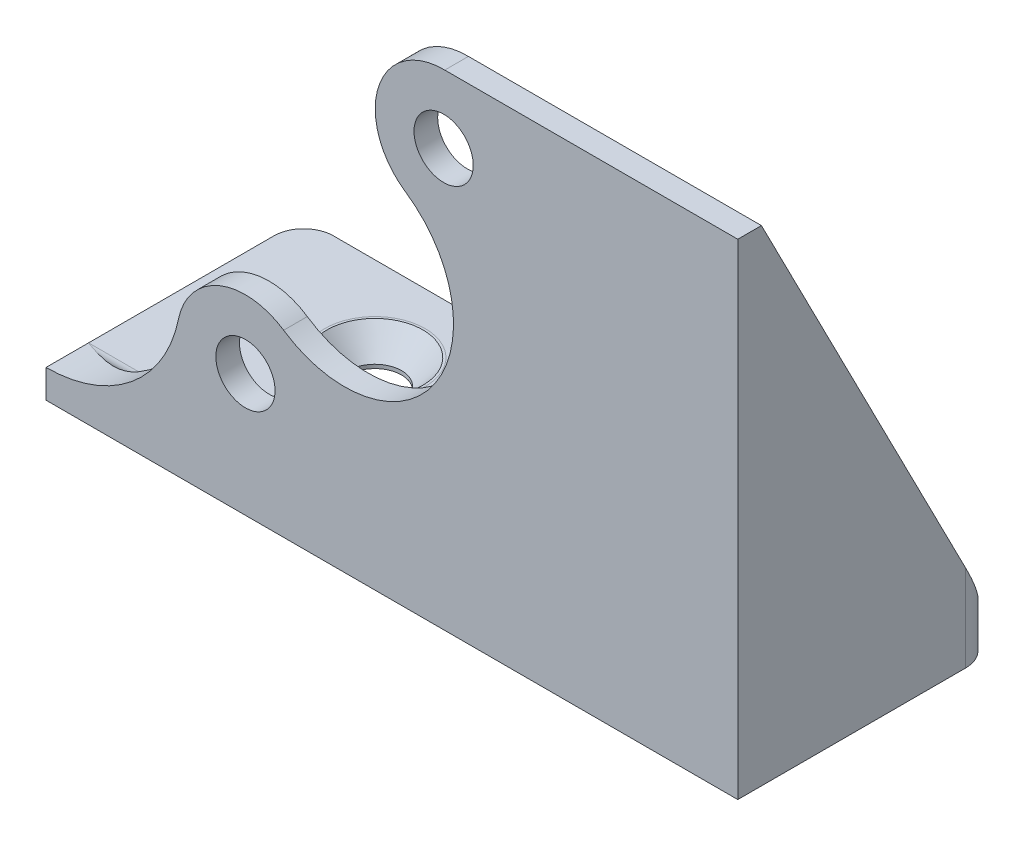
from build123d import *

# Parameters (mm, degrees)
SKETCH2_W                                   = 101.6
SKETCH2_H                                   = 127
BOSS_EXTRUDE1_DEPTH                         = 3.175
SKETCH5_R                                   = 3.9751
CUT_EXTRUDE1_DEPTH                          = 3.175
BOSS_EXTRUDE3_DEPTH                         = 92.87256
BOSS_EXTRUDE4_DEPTH                         = 6.35
SKETCH18_R                                  = 3.175
CUT_EXTRUDE3_DEPTH                          = 6.8072
FILLET4_R                                   = 4.0005
CUT_EXTRUDE4_DEPTH                          = 34.5948
CUT_EXTRUDE5_DEPTH                          = 2.9972
FILLET7_R                                   = 2.54
CSK_FOR_1_4_FLAT_HEAD_MACHINE_SCREW_2_COUNT = 2
CSK_FOR_1_4_FLAT_HEAD_MACHINE_SCREW_2_PITCH = 55.9


with BuildPart() as part:
    # Sketch2 → Boss-Extrude1 (new body)
    with BuildSketch(Plane.XY):
        with Locations((50.8, 63.5)):
            Rectangle(SKETCH2_W, SKETCH2_H)
    extrude(amount=BOSS_EXTRUDE1_DEPTH)

    # Sketch5 → Cut-Extrude1 (cut)
    with BuildSketch(Plane(origin=(0, 0, 0), x_dir=(-1, 0, 0), z_dir=(0, 0, -1))):
        with BuildLine():
            Line((-81.586228812, 65.152573183), (-58.571239337, 65.152573183))
            ThreePointArc((-58.571239337, 65.152573183), (-49.65943867, 58.729036089), (-53.287760408, 48.359981104))
            ThreePointArc((-53.287760408, 48.359981104), (-57.249364207, 28.049269577), (-36.93865268, 24.087665778))
            ThreePointArc((-36.93865268, 24.087665778), (-28.337713232, 24.971703827), (-22.817162059, 18.317291951))
            ThreePointArc((-22.817162059, 18.317291951), (-16.509170131, 7.896881921), (-5.03428, 3.81))
            Line((-5.03428, 3.81), (-5.03428, 0))
            Line((-5.03428, 0), (0, 0))
            Line((0, 0), (0, 127))
            Line((0, 127), (-101.6, 127))
            Line((-101.6, 127), (-101.6, 0))
            Line((-101.6, 0), (-97.90684, 0))
            Line((-97.90684, 0), (-97.90684, 65.152573183))
            Line((-97.90684, 65.152573183), (-81.586228812, 65.152573183))
        make_face()
        with Locations((-58.416247506, 55.973867932)):
            Circle(SKETCH5_R)
        with Locations((-31.810165582, 16.473778949)):
            Circle(SKETCH5_R)
    extrude(amount=-CUT_EXTRUDE1_DEPTH, mode=Mode.SUBTRACT)

    # Sketch10 → Boss-Extrude3 (add)
    with BuildSketch(Plane(origin=(5.03428, 0, 0), x_dir=(0, 0, -1), z_dir=(1, 0, 0))):
        Polygon((-3.175, 0), (-4.2418, 0), (-4.2418, -2.9972), (-34.5948, -2.9972), (-34.5948, 0), (-34.5948, 3.81), (-3.175, 3.81), align=None)
    extrude(amount=BOSS_EXTRUDE3_DEPTH)

    # Sketch11 → Boss-Extrude4 (add)
    with BuildSketch(Plane(origin=(97.90684, 0, 0), x_dir=(0, 0, -1), z_dir=(1, 0, 0))):
        Polygon((-3.175, 65.152573183), (-3.175, 3.81), (-34.5948, 3.81), align=None)
    extrude(amount=-BOSS_EXTRUDE4_DEPTH)

    # Sketch18 → Cut-Extrude3 (cut)
    with BuildSketch(Plane.XZ.offset(2.9972)):
        with Locations(Location((25.968032816, 23.228300068, 0), (0, 0, 270))):
            Circle(SKETCH18_R)
        with Locations(Location((81.868032816, 23.228300068, 0), (0, 0, 270))):
            Circle(SKETCH18_R)
    extrude(amount=-CUT_EXTRUDE3_DEPTH, mode=Mode.SUBTRACT)

    # Fillet4
    fillet4_edges = [part.edges().sort_by_distance(p)[0] for p in [
        (97.90684, -1.4986, 4.2418),
        (5.03428, -1.4986, 4.2418),
        (97.90684, 0.4064, 34.5948),
        (5.03428, 0.4064, 34.5948),
    ]]
    fillet(fillet4_edges, radius=FILLET4_R)

    # Mirror5: part across plane


with BuildPart() as part_1:
    add(part.part)
    add(part.part.mirror(Plane.XY))

    # Sketch25 → Cut-Extrude4 (cut)
    with BuildSketch(Plane.XY):
        Polygon((105.475480197, -15.241589329), (106.840773124, 71.833759528), (-8.541984089, 73.642896836), (-9.907277015, -13.432452021), align=None)
    extrude(amount=CUT_EXTRUDE4_DEPTH, mode=Mode.SUBTRACT)

    # Sketch28 → Cut-Extrude5 (cut)
    with BuildSketch(Plane.XZ.offset(2.9972)):
        with BuildLine():
            Line((93.90634, -4.2418), (9.03478, -4.2418))
            ThreePointArc((9.03478, -4.2418), (6.205999322, -5.413519322), (5.03428, -8.2423))
            Line((5.03428, -8.2423), (5.03428, -30.5943))
            ThreePointArc((5.03428, -30.5943), (6.205999322, -33.423080678), (9.03478, -34.5948))
            Line((9.03478, -34.5948), (93.90634, -34.5948))
            ThreePointArc((93.90634, -34.5948), (96.735120678, -33.423080678), (97.90684, -30.5943))
            Line((97.90684, -30.5943), (97.90684, -8.2423))
            ThreePointArc((97.90684, -8.2423), (96.735120678, -5.413519322), (93.90634, -4.2418))
        make_face()
    extrude(amount=-CUT_EXTRUDE5_DEPTH, mode=Mode.SUBTRACT)

    # Fillet7
    # the kernel refuses this fillet: 2.54 mm, written as the material it adds along each edge
    with BuildSketch(Plane(origin=(89.01684, 6.35, -5.715), x_dir=(0, -1, 0), z_dir=(1, 0, 0))) as fillet7_piece_1_section:
        Polygon((0, 0), (FILLET7_R, 0), (FILLET7_R, -FILLET7_R), (0, -FILLET7_R), align=None)
    fillet7_piece_1 = extrude(amount=FILLET7_R, mode=Mode.PRIVATE)
    fillet7_piece_1 = fillet7_piece_1 - Plane(origin=(89.01684, 6.35, -5.715), x_dir=(0, 0.7071067811865475, -0.7071067811865477), z_dir=(1, 0, 0)) * Sphere(FILLET7_R, mode=Mode.PRIVATE)
    add(fillet7_piece_1)
    with BuildSketch(Plane(origin=(5.03428, 3.81, -3.175), x_dir=(0, 0, -1), z_dir=(1, 0, 0))) as fillet7_piece_2_section:
        with BuildLine():
            CenterArc((FILLET7_R, FILLET7_R), FILLET7_R, 180, 90)
            Line((0, FILLET7_R), (0, 0))
            Line((0, 0), (FILLET7_R, 0))
        make_face()
    fillet7_piece_2 = extrude(amount=83.98256, mode=Mode.PRIVATE)
    fillet7_piece_2 = fillet7_piece_2 - Plane(origin=(5.03428, 21.962678524, -3.760034689), x_dir=(0.9796285454928902, -0.20081810888334822, 0), z_dir=(0, 0, -1)) * Cylinder(18.152678524, 179, mode=Mode.PRIVATE)
    add(fillet7_piece_2)
    with BuildSketch(Plane(origin=(91.55684, 3.81, -5.715), x_dir=(-1, 0, 0), z_dir=(0, 0, -1))) as fillet7_piece_3_section:
        with BuildLine():
            CenterArc((FILLET7_R, FILLET7_R), FILLET7_R, 180, 90)
            Line((0, FILLET7_R), (0, 0))
            Line((0, 0), (FILLET7_R, 0))
        make_face()
    fillet7_piece_3 = extrude(amount=28.8798, mode=Mode.PRIVATE)
    fillet7_piece_3 = split(fillet7_piece_3, bisect_by=Plane(origin=(90.978646613, 10.179733651, -31.332208508), z_dir=(0, -0.4558808495345019, 0.8900408142482573)), keep=Keep.TOP, mode=Mode.PRIVATE)
    add(fillet7_piece_3)
    with BuildSketch(Plane(origin=(91.55684, 65.152573183, -3.175), x_dir=(0, 0, -1), z_dir=(0, -1, 0))) as fillet7_piece_4_section:
        with BuildLine():
            CenterArc((FILLET7_R, -FILLET7_R), FILLET7_R, 90, 90)
            Line((0, -FILLET7_R), (0, 0))
            Line((0, 0), (FILLET7_R, 0))
        make_face()
    fillet7_piece_4 = extrude(amount=58.802573183, mode=Mode.PRIVATE)
    fillet7_piece_4 = split(fillet7_piece_4, bisect_by=Plane(origin=(90.975846211, 41.193986982, -15.446640195), z_dir=(0, -0.4558808495345019, 0.8900408142482573)), keep=Keep.TOP, mode=Mode.PRIVATE)
    add(fillet7_piece_4)

    # Sketch35 → CSK for 1/4 Flat Head Machine Screw (100)1 (revolve, cut)
    with BuildSketch(Plane(origin=(25.968032816, 3.81, -23.228300068), x_dir=(0, 0, 1), z_dir=(1, 0, 0))):
        Polygon((0, 0), (0, 3.81), (3.57124, 3.81), (3.57124, 3.298865467), (6.4389, 0), align=None)
    csk_for_1_4_flat_head_machine_screw_100 = revolve(axis=Axis((25.968032816, 10.16, -23.228300068), (0, -1, 0)), mode=Mode.SUBTRACT)

    # CSK for 1_4 Flat Head Machine Screw  2: CSK for 1/4 Flat Head Machine Screw (100)1 ×2
    with Locations(*[(i * CSK_FOR_1_4_FLAT_HEAD_MACHINE_SCREW_2_PITCH, 0, 0) for i in range(1, CSK_FOR_1_4_FLAT_HEAD_MACHINE_SCREW_2_COUNT)]):
        add(csk_for_1_4_flat_head_machine_screw_100, mode=Mode.SUBTRACT)


solid = part_1.part
